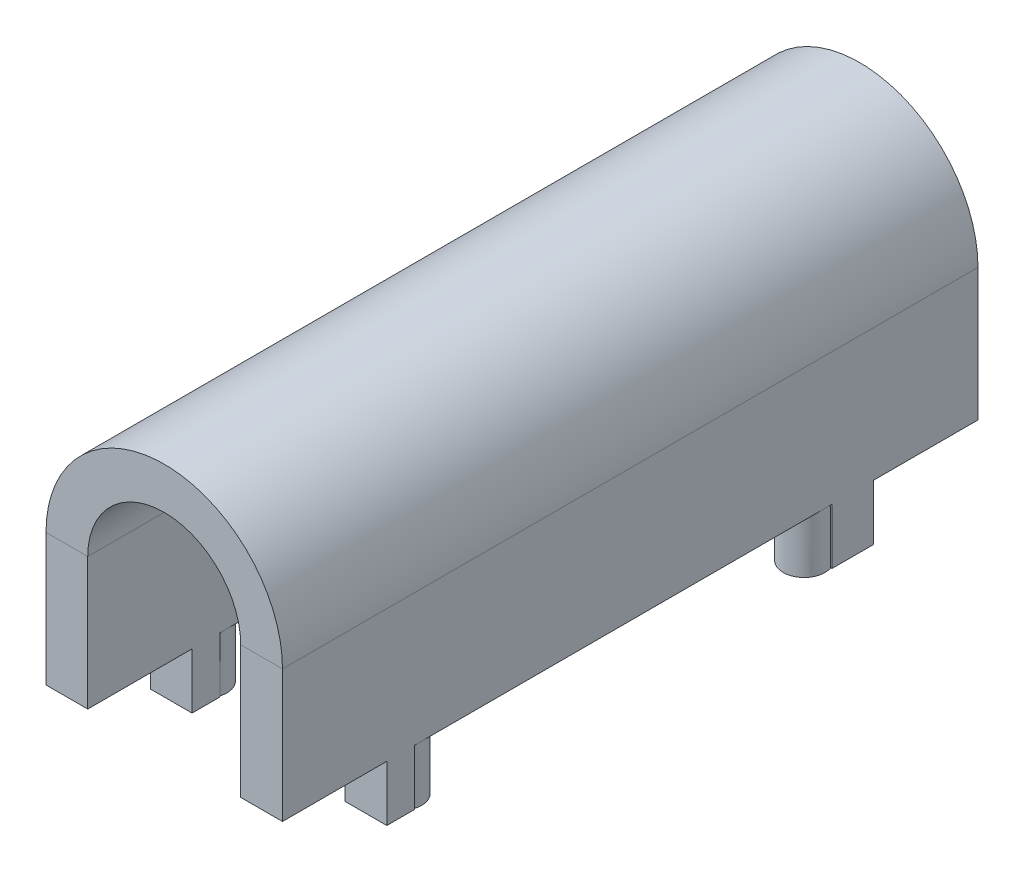
from build123d import *

# Parameters (mm, degrees)
SM_BASE_FLANGE_1_DEPTH = 25
SKETCH_6_W             = 3.75
SKETCH_6_H             = 2
SKETCH_6_W_2           = 15
CUT_EXTRUDE_1_DEPTH    = 10
SKETCH_7_R             = 0.75
EXTRUDE_1_DEPTH        = 2


# Sheet-metal steps are written as plain solids
with BuildPart() as part:
    # Sketch 2 → 基体-法兰1 (new body)
    with BuildSketch(Plane.XY):
        with BuildLine():
            Line((4.25, -6.75), (4.25, 0))
            ThreePointArc((4.25, 0), (0, 4.25), (-4.25, 0))
            Line((-4.25, 0), (-4.25, -6.75))
            Line((-4.25, -6.75), (-2.75, -6.75))
            Line((-2.75, -6.75), (-2.75, 0))
            ThreePointArc((-2.75, 0), (0, 2.75), (2.75, 0))
            Line((2.75, 0), (2.75, -6.75))
            Line((2.75, -6.75), (4.25, -6.75))
        make_face()
    extrude(amount=SM_BASE_FLANGE_1_DEPTH)

    # 草图6 → 切除-拉伸1 (cut)
    with BuildSketch(Plane.ZY.offset(4.25)):
        with Locations((1.875, -5.75)):
            Rectangle(SKETCH_6_W, SKETCH_6_H)
        with Locations((12.75, -5.75)):
            Rectangle(SKETCH_6_W_2, SKETCH_6_H)
        with Locations((23.125, -5.75)):
            Rectangle(SKETCH_6_W, SKETCH_6_H)
    extrude(amount=-CUT_EXTRUDE_1_DEPTH, mode=Mode.SUBTRACT)

    # 草图7 → 凸台-拉伸1 (add)
    with BuildSketch(Plane.XZ.offset(4.75)):
        with Locations((-3.5, 20)):
            Circle(SKETCH_7_R)
        with Locations((-3.5, 5.5)):
            Circle(SKETCH_7_R)
        with Locations((3.5, 5.5)):
            Circle(SKETCH_7_R)
        with Locations((3.5, 20)):
            Circle(SKETCH_7_R)
    extrude(amount=EXTRUDE_1_DEPTH)


solid = part.part
